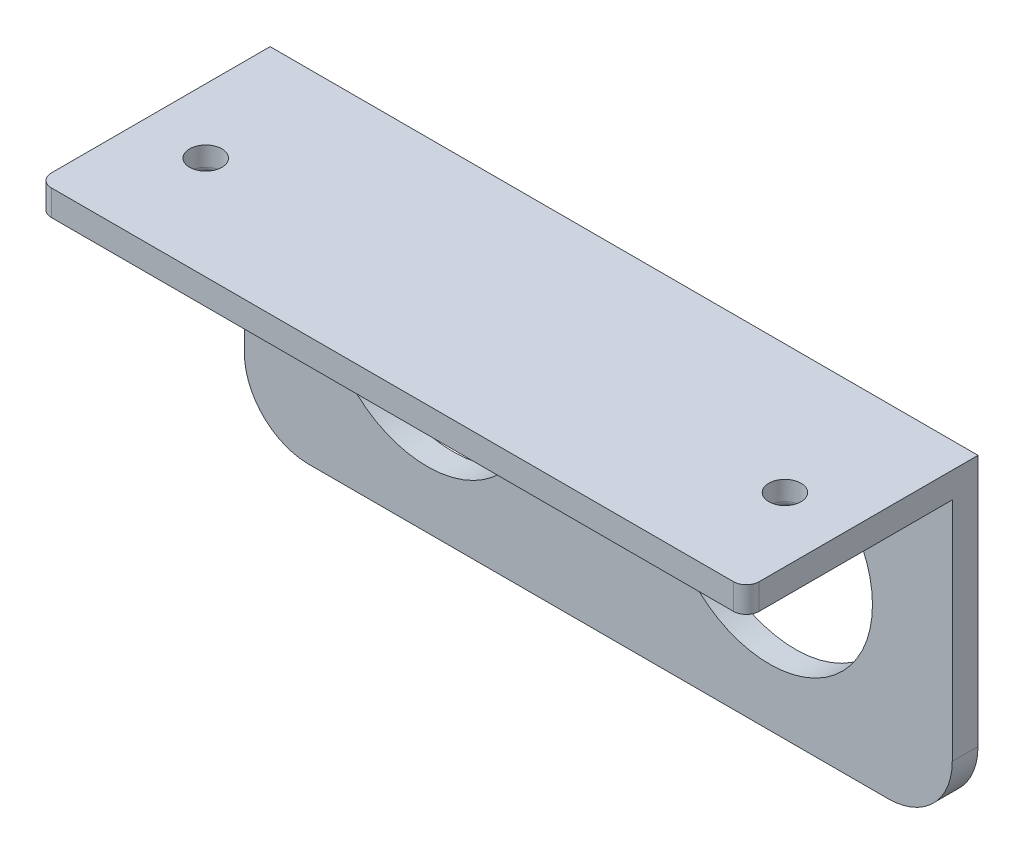
from build123d import *

# Parameters (mm, degrees)
SKETCH1_W             = 55
SKETCH1_H             = 22.6
BOSS_EXTRUDE1_DEPTH   = 2
SKETCH2_R             = 8
CUT_EXTRUDE2_DEPTH    = 2
SKETCH2_4_R           = 8
CUT_EXTRUDE3_DEPTH    = 2
SKETCH5_W             = 11
SKETCH5_H             = 5.5
CUT_EXTRUDE4_DEPTH    = 2
SKETCH6_W             = 55
SKETCH6_H             = 2
BOSS_EXTRUDE2_DEPTH   = 18
M3X0_5_TAPPED_HOLE1_D = 2.5
M3X0_5_TAPPED_HOLE2_D = 2.5
FILLET1_R             = 5
FILLET2_R             = 5
FILLET4_R             = 1.8
FILLET5_R             = 1.8
FILLET10_R            = 1
FILLET12_R            = 0.5
FILLET13_R            = 0.5


with BuildPart() as part:
    # Sketch1 → Boss-Extrude1 (new body)
    with BuildSketch(Plane.XY):
        with Locations((-1.071942446, 12.368165468)):
            Rectangle(SKETCH1_W, SKETCH1_H)
    extrude(amount=BOSS_EXTRUDE1_DEPTH)

    # Sketch2 → Cut-Extrude2 (cut)
    with BuildSketch(Plane.XY.offset(2)):
        with Locations((-14.371942446, 13.518165468)):
            Circle(SKETCH2_R)
    extrude(amount=-CUT_EXTRUDE2_DEPTH, mode=Mode.SUBTRACT)

    # Sketch2<4> → Cut-Extrude3 (cut)
    with BuildSketch(Plane.XY.offset(2)):
        with Locations((-14.371942446, 13.518165468)):
            Circle(SKETCH2_4_R)
        with Locations((12.228057554, 13.518165468)):
            Circle(SKETCH2_4_R)
    extrude(amount=-CUT_EXTRUDE3_DEPTH, mode=Mode.SUBTRACT)

    # Sketch5 → Cut-Extrude4 (cut)
    with BuildSketch(Plane.XY.offset(2)):
        with Locations((-1.071942446, 20.918165468)):
            Rectangle(SKETCH5_W, SKETCH5_H)
    extrude(amount=-CUT_EXTRUDE4_DEPTH, mode=Mode.SUBTRACT)

    # Sketch6 → Boss-Extrude2 (add)
    with BuildSketch(Plane(origin=(0, 0, 0), x_dir=(-1, 0, 0), z_dir=(0, 0, -1))):
        with Locations((1.071942446, 24.668165468)):
            Rectangle(SKETCH6_W, SKETCH6_H)
    extrude(amount=-BOSS_EXTRUDE2_DEPTH)

    # M3x0.5 Tapped Hole1 (through all)
    with Locations(Plane(origin=(0, 23.668165468, 0), x_dir=(-1, 0, 0), z_dir=(0, -1, 0))):
        with Locations((-21.428057554, -10)):
            Hole(M3X0_5_TAPPED_HOLE1_D / 2)

    # M3x0.5 Tapped Hole2 (through all)
    with Locations(Plane(origin=(0, 23.668165468, 0), x_dir=(-1, 0, 0), z_dir=(0, -1, 0))):
        with Locations((23.571942446, -10)):
            Hole(M3X0_5_TAPPED_HOLE2_D / 2)

    # Fillet1
    fillet1_edges = [part.edges().sort_by_distance(p)[0] for p in [
        (-28.571942446, 1.068165468, 1),
    ]]
    fillet(fillet1_edges, radius=FILLET1_R)

    # Fillet2
    fillet2_edges = [part.edges().sort_by_distance(p)[0] for p in [
        (26.428057554, 1.068165468, 1),
    ]]
    fillet(fillet2_edges, radius=FILLET2_R)

    # Fillet4
    fillet4_edges = [part.edges().sort_by_distance(p)[0] for p in [
        (4.428057554, 18.168165468, 1),
    ]]
    fillet(fillet4_edges, radius=FILLET4_R)

    # Fillet5
    fillet5_edges = [part.edges().sort_by_distance(p)[0] for p in [
        (-6.571942446, 18.168165468, 1),
    ]]
    fillet(fillet5_edges, radius=FILLET5_R)

    # Fillet10
    fillet10_edges = [part.edges().sort_by_distance(p)[0] for p in [
        (26.428057554, 24.668165468, 18),
        (-28.571942446, 24.668165468, 18),
    ]]
    fillet(fillet10_edges, radius=FILLET10_R)

    # Fillet12
    fillet12_edges = [part.edges().sort_by_distance(p)[0] for p in [
        (-24.821942446, 23.668165468, 10),
    ]]
    fillet(fillet12_edges, radius=FILLET12_R)

    # Fillet13
    fillet13_edges = [part.edges().sort_by_distance(p)[0] for p in [
        (20.178057554, 23.668165468, 10),
    ]]
    fillet(fillet13_edges, radius=FILLET13_R)


solid = part.part
